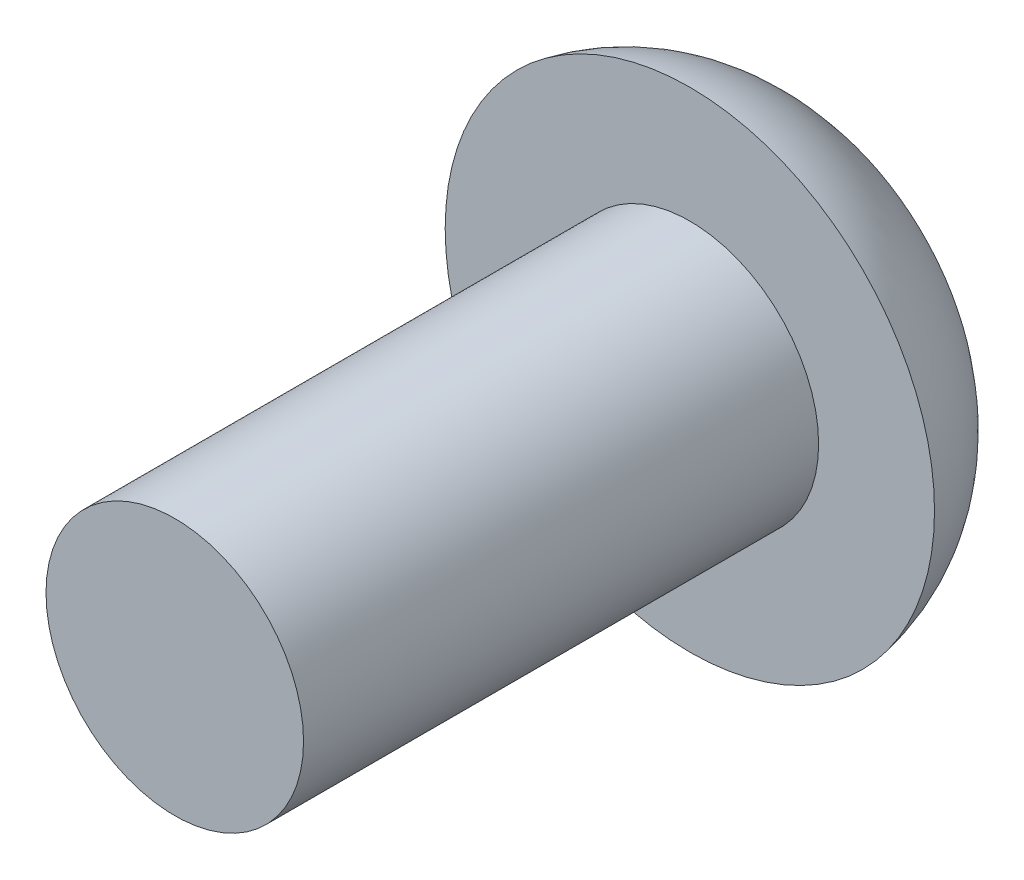
from build123d import *

# Parameters (mm, degrees)
SKETCH_1_R      = 1.5
EXTRUDE_1_DEPTH = 6
SKETCH_2_R      = 2.85
EXTRUDE_2_DEPTH = 1.65
FILLET_1_R      = 2


with BuildPart() as part:
    # 草图1 → 凸台-拉伸1 (new body)
    with BuildSketch(Plane.XY):
        Circle(SKETCH_1_R)
    extrude(amount=EXTRUDE_1_DEPTH)

    # 草图2 → 凸台-拉伸2 (add)
    with BuildSketch(Plane(origin=(0, 0, 0), x_dir=(-1, 0, 0), z_dir=(0, 0, -1))):
        Circle(SKETCH_2_R)
    extrude(amount=EXTRUDE_2_DEPTH)

    # 圆角1
    # the kernel refuses this fillet: 2 mm, written as the material it takes off along each edge
    with BuildSketch(Plane(origin=(0, 0, -1.65), x_dir=(-1, 0, 0), z_dir=(0, -1, 0))) as fillet_1_piece_1:
        with BuildLine():
            CenterArc((0.880863133, -2), FILLET_1_R, 10.078658108, 79.921341892)
            Line((0.880863133, 0), (0.880863133, 0.04))
            Line((0.880863133, 0.04), (2.85, 0.04))
            Line((2.85, 0.04), (2.89, 0))
            ThreePointArc((2.89, 0), (2.89, -0.825), (2.889382737, -1.643))
            Line((2.889382737, -1.643), (2.85, -1.65))
        make_face()
    revolve(axis=Axis((0, 0, -1.65), (0, 0, -1)), mode=Mode.SUBTRACT)


solid = part.part
